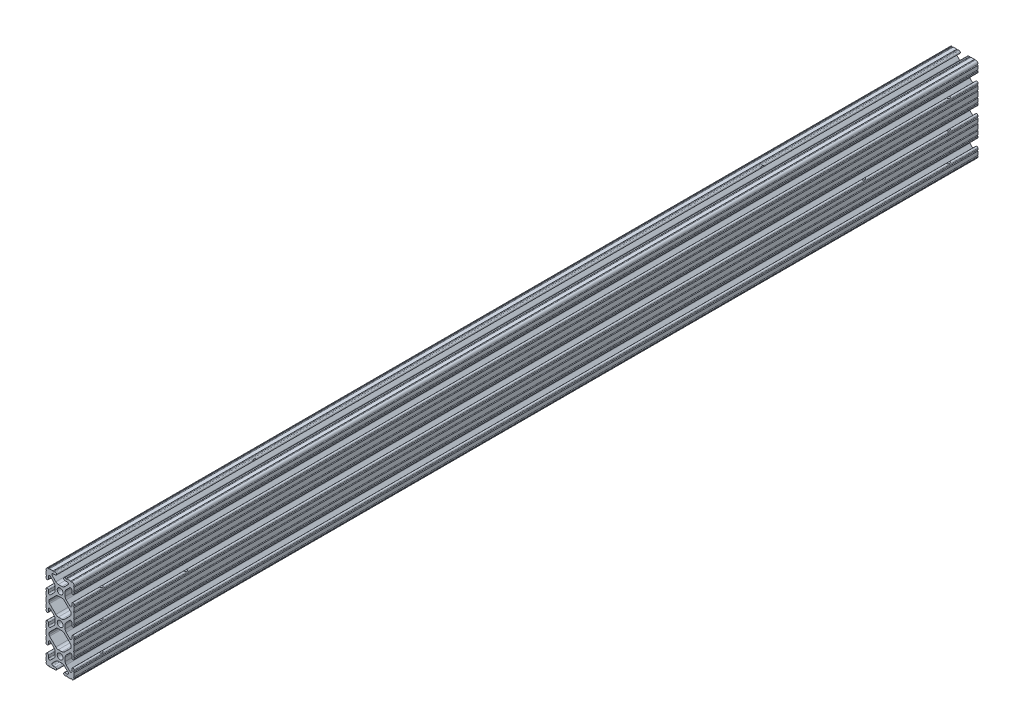
from build123d import *

# Parameters (mm, degrees)
SKETCH1_R               = 2.6035
BOSS_EXTRUDE1_DEPTH     = 406.4
CUT_EXTRUDE1_DEPTH      = 409.544636002
CUT_EXTRUDE1_DEPTH_BACK = 409.544636002
SKETCH2_R               = 3.5
CUT_EXTRUDE2_DEPTH      = 409.544636102
CUT_EXTRUDE2_DEPTH_BACK = 409.544636102
SKETCH3_R               = 3.5
CUT_EXTRUDE3_DEPTH      = 413.246808546
CUT_EXTRUDE3_DEPTH_BACK = 413.246808546
SKETCH4_R               = 3.5


with BuildPart() as part:
    # Sketch1 → Boss-Extrude1 (new, symmetric)
    with BuildSketch(Plane.XY):
        with BuildLine():
            Line((-12.7, 34.9504), (-12.7, 31.7246))
            ThreePointArc((-12.7, 31.7246), (-12.192, 31.2166), (-12.7, 30.7086))
            Line((-12.7, 30.7086), (-12.7, 29.702307889))
            ThreePointArc((-12.7, 29.702307889), (-11.5951, 28.597407889), (-10.4902, 29.702307889))
            Line((-10.4902, 29.702307889), (-10.4902, 31.874794456))
            ThreePointArc((-10.4902, 31.874794456), (-9.863006367, 32.813456061), (-8.75577951, 32.593214945))
            Line((-8.75577951, 32.593214945), (-5.43843597, 29.275871405))
            ThreePointArc((-5.43843597, 29.275871405), (-4.750182484, 28.245827272), (-4.5085, 27.030807374))
            Line((-4.5085, 27.030807374), (-4.5085, 23.769192626))
            ThreePointArc((-4.5085, 23.769192626), (-4.750182484, 22.554172728), (-5.43843597, 21.524128595))
            Line((-5.43843597, 21.524128595), (-8.75577951, 18.206785055))
            ThreePointArc((-8.75577951, 18.206785055), (-9.863006367, 17.986543939), (-10.4902, 18.925205544))
            Line((-10.4902, 18.925205544), (-10.4902, 21.097692111))
            ThreePointArc((-10.4902, 21.097692111), (-11.5951, 22.202592111), (-12.7, 21.097692111))
            Line((-12.7, 21.097692111), (-12.7, 20.0914))
            ThreePointArc((-12.7, 20.0914), (-12.192, 19.5834), (-12.7, 19.0754))
            Line((-12.7, 19.0754), (-12.7, 15.8496))
            ThreePointArc((-12.7, 15.8496), (-12.192, 15.3416), (-12.7, 14.8336))
            Line((-12.7, 14.8336), (-12.7, 10.5664))
            ThreePointArc((-12.7, 10.5664), (-12.192, 10.0584), (-12.7, 9.5504))
            Line((-12.7, 9.5504), (-12.7, 6.3246))
            ThreePointArc((-12.7, 6.3246), (-12.192000017, 5.8166), (-12.7, 5.3086))
            Line((-12.7, 5.3086), (-12.7, 4.302307889))
            ThreePointArc((-12.7, 4.302307889), (-11.5951, 3.197407889), (-10.4902, 4.302307889))
            Line((-10.4902, 4.302307889), (-10.4902, 6.474794456))
            ThreePointArc((-10.4902, 6.474794456), (-9.863006367, 7.413456061), (-8.75577951, 7.193214945))
            Line((-8.75577951, 7.193214945), (-5.43843597, 3.875871405))
            ThreePointArc((-5.43843597, 3.875871405), (-4.750182484, 2.845827272), (-4.5085, 1.630807374))
            Line((-4.5085, 1.630807374), (-4.5085, -1.630807374))
            ThreePointArc((-4.5085, -1.630807374), (-4.750182484, -2.845827272), (-5.43843597, -3.875871405))
            Line((-5.43843597, -3.875871405), (-8.75577951, -7.193214945))
            ThreePointArc((-8.75577951, -7.193214945), (-9.863006367, -7.413456061), (-10.4902, -6.474794456))
            Line((-10.4902, -6.474794456), (-10.4902, -4.302307889))
            ThreePointArc((-10.4902, -4.302307889), (-11.5951, -3.197407889), (-12.7, -4.302307889))
            Line((-12.7, -4.302307889), (-12.7, -5.3086))
            ThreePointArc((-12.7, -5.3086), (-12.191999983, -5.8166), (-12.7, -6.3246))
            Line((-12.7, -6.3246), (-12.7, -9.5504))
            ThreePointArc((-12.7, -9.5504), (-12.192, -10.0584), (-12.7, -10.5664))
            Line((-12.7, -10.5664), (-12.7, -14.8336))
            ThreePointArc((-12.7, -14.8336), (-12.192, -15.3416), (-12.7, -15.8496))
            Line((-12.7, -15.8496), (-12.7, -19.0754))
            ThreePointArc((-12.7, -19.0754), (-12.192, -19.5834), (-12.7, -20.0914))
            Line((-12.7, -20.0914), (-12.7, -21.097692111))
            ThreePointArc((-12.7, -21.097692111), (-11.5951, -22.202592111), (-10.4902, -21.097692111))
            Line((-10.4902, -21.097692111), (-10.4902, -18.925205544))
            ThreePointArc((-10.4902, -18.925205544), (-9.863006367, -17.986543939), (-8.75577951, -18.206785055))
            Line((-8.75577951, -18.206785055), (-5.43843597, -21.524128595))
            ThreePointArc((-5.43843597, -21.524128595), (-4.750182484, -22.554172728), (-4.5085, -23.769192626))
            Line((-4.5085, -23.769192626), (-4.5085, -27.030807374))
            ThreePointArc((-4.5085, -27.030807374), (-4.750182484, -28.245827272), (-5.43843597, -29.275871405))
            Line((-5.43843597, -29.275871405), (-8.75577951, -32.593214945))
            ThreePointArc((-8.75577951, -32.593214945), (-9.863006367, -32.813456061), (-10.4902, -31.874794456))
            Line((-10.4902, -31.874794456), (-10.4902, -29.702307889))
            ThreePointArc((-10.4902, -29.702307889), (-11.5951, -28.597407889), (-12.7, -29.702307889))
            Line((-12.7, -29.702307889), (-12.7, -30.7086))
            ThreePointArc((-12.7, -30.7086), (-12.192, -31.2166), (-12.7, -31.7246))
            Line((-12.7, -31.7246), (-12.7, -34.9504))
            ThreePointArc((-12.7, -34.9504), (-12.192, -35.4584), (-12.7, -35.9664))
            ThreePointArc((-12.7, -35.9664), (-12.082677406, -37.482677406), (-10.5664, -38.1))
            ThreePointArc((-10.5664, -38.1), (-10.0584, -37.592), (-9.5504, -38.1))
            Line((-9.5504, -38.1), (-6.3246, -38.1))
            ThreePointArc((-6.3246, -38.1), (-5.816599996, -37.592000017), (-5.3086, -38.100000008))
            Line((-5.3086, -38.100000008), (-4.302307889, -38.100000008))
            ThreePointArc((-4.302307889, -38.100000008), (-3.197407889, -36.995100008), (-4.302307889, -35.890200008))
            Line((-4.302307889, -35.890200008), (-6.474794456, -35.890200008))
            ThreePointArc((-6.474794456, -35.890200008), (-7.413456061, -35.263006376), (-7.193214945, -34.155779519))
            Line((-7.193214945, -34.155779519), (-3.875871405, -30.838435978))
            ThreePointArc((-3.875871405, -30.838435978), (-2.845827272, -30.150182493), (-1.630807374, -29.908500008))
            Line((-1.630807374, -29.908500008), (1.630807374, -29.908500008))
            ThreePointArc((1.630807374, -29.908500008), (2.845827272, -30.150182493), (3.875871405, -30.838435978))
            Line((3.875871405, -30.838435978), (7.193214945, -34.155779519))
            ThreePointArc((7.193214945, -34.155779519), (7.413456061, -35.263006376), (6.474794456, -35.890200008))
            Line((6.474794456, -35.890200008), (4.302307889, -35.890200008))
            ThreePointArc((4.302307889, -35.890200008), (3.197407889, -36.995100008), (4.302307889, -38.100000008))
            Line((4.302307889, -38.100000008), (5.3086, -38.100000008))
            ThreePointArc((5.3086, -38.100000008), (5.8166, -37.591999992), (6.3246, -38.100000008))
            Line((6.3246, -38.100000008), (9.5504, -38.100000008))
            ThreePointArc((9.5504, -38.100000008), (10.0584, -37.592000008), (10.5664, -38.100000008))
            ThreePointArc((10.5664, -38.100000008), (12.082677406, -37.482677414), (12.7, -35.966400008))
            ThreePointArc((12.7, -35.966400008), (12.192, -35.458400008), (12.7, -34.950400008))
            Line((12.7, -34.950400008), (12.7, -31.724600008))
            ThreePointArc((12.7, -31.724600008), (12.192, -31.216600008), (12.7, -30.708600008))
            Line((12.7, -30.708600008), (12.7, -29.702307926))
            ThreePointArc((12.7, -29.702307926), (11.5951, -28.597407926), (10.4902, -29.702307926))
            Line((10.4902, -29.702307926), (10.4902, -31.874794464))
            ThreePointArc((10.4902, -31.874794464), (9.863006367, -32.813456069), (8.75577951, -32.593214954))
            Line((8.75577951, -32.593214954), (5.43843597, -29.275871413))
            ThreePointArc((5.43843597, -29.275871413), (4.750182484, -28.245827281), (4.5085, -27.030807383))
            Line((4.5085, -27.030807383), (4.5085, -23.769192634))
            ThreePointArc((4.5085, -23.769192634), (4.750182484, -22.554172736), (5.43843597, -21.524128604))
            Line((5.43843597, -21.524128604), (8.75577951, -18.206785063))
            ThreePointArc((8.75577951, -18.206785063), (9.863006367, -17.986543948), (10.4902, -18.925205553))
            Line((10.4902, -18.925205553), (10.4902, -21.097692067))
            ThreePointArc((10.4902, -21.097692067), (11.5951, -22.202592067), (12.7, -21.097692067))
            Line((12.7, -21.097692067), (12.7, -20.091400008))
            ThreePointArc((12.7, -20.091400008), (12.192, -19.583400008), (12.7, -19.075400008))
            Line((12.7, -19.075400008), (12.7, -15.849600008))
            ThreePointArc((12.7, -15.849600008), (12.192, -15.341600008), (12.7, -14.833600008))
            Line((12.7, -14.833600008), (12.7, -10.566400008))
            ThreePointArc((12.7, -10.566400008), (12.192, -10.058400008), (12.7, -9.550400008))
            Line((12.7, -9.550400008), (12.7, -6.324600008))
            ThreePointArc((12.7, -6.324600008), (12.192000017, -5.816600008), (12.7, -5.308600008))
            Line((12.7, -5.308600008), (12.7, -4.302307897))
            ThreePointArc((12.7, -4.302307897), (11.5951, -3.197407897), (10.4902, -4.302307897))
            Line((10.4902, -4.302307897), (10.4902, -6.474794464))
            ThreePointArc((10.4902, -6.474794464), (9.863006367, -7.413456069), (8.75577951, -7.193214954))
            Line((8.75577951, -7.193214954), (5.43843597, -3.875871413))
            ThreePointArc((5.43843597, -3.875871413), (4.750182484, -2.845827281), (4.5085, -1.630807383))
            Line((4.5085, -1.630807383), (4.5085, 1.630807366))
            ThreePointArc((4.5085, 1.630807366), (4.750182484, 2.845827264), (5.43843597, 3.875871396))
            Line((5.43843597, 3.875871396), (8.75577951, 7.193214937))
            ThreePointArc((8.75577951, 7.193214937), (9.863006367, 7.413456052), (10.4902, 6.474794447))
            Line((10.4902, 6.474794447), (10.4902, 4.302307881))
            ThreePointArc((10.4902, 4.302307881), (11.5951, 3.197407881), (12.7, 4.302307881))
            Line((12.7, 4.302307881), (12.7, 5.308599992))
            ThreePointArc((12.7, 5.308599992), (12.191999983, 5.816599992), (12.7, 6.324599992))
            Line((12.7, 6.324599992), (12.7, 9.550399992))
            ThreePointArc((12.7, 9.550399992), (12.192, 10.058399992), (12.7, 10.566399992))
            Line((12.7, 10.566399992), (12.7, 14.833599992))
            ThreePointArc((12.7, 14.833599992), (12.192, 15.341599992), (12.7, 15.849599992))
            Line((12.7, 15.849599992), (12.7, 19.075399992))
            ThreePointArc((12.7, 19.075399992), (12.192, 19.583399992), (12.7, 20.091399992))
            Line((12.7, 20.091399992), (12.7, 21.097692074))
            ThreePointArc((12.7, 21.097692074), (11.5951, 22.202592074), (10.4902, 21.097692074))
            Line((10.4902, 21.097692074), (10.4902, 18.925205536))
            ThreePointArc((10.4902, 18.925205536), (9.863006367, 17.986543931), (8.75577951, 18.206785046))
            Line((8.75577951, 18.206785046), (5.43843597, 21.524128587))
            ThreePointArc((5.43843597, 21.524128587), (4.750182484, 22.554172719), (4.5085, 23.769192617))
            Line((4.5085, 23.769192617), (4.5085, 27.030807366))
            ThreePointArc((4.5085, 27.030807366), (4.750182484, 28.245827264), (5.43843597, 29.275871396))
            Line((5.43843597, 29.275871396), (8.75577951, 32.593214937))
            ThreePointArc((8.75577951, 32.593214937), (9.863006367, 32.813456052), (10.4902, 31.874794447))
            Line((10.4902, 31.874794447), (10.4902, 29.702307881))
            ThreePointArc((10.4902, 29.702307881), (11.5951, 28.597407881), (12.7, 29.702307881))
            Line((12.7, 29.702307881), (12.7, 30.708599992))
            ThreePointArc((12.7, 30.708599992), (12.192, 31.216599992), (12.7, 31.724599992))
            Line((12.7, 31.724599992), (12.7, 34.9504))
            ThreePointArc((12.7, 34.9504), (12.192, 35.4584), (12.7, 35.9664))
            ThreePointArc((12.7, 35.9664), (12.082677406, 37.482677406), (10.5664, 38.1))
            ThreePointArc((10.5664, 38.1), (10.0584, 37.592), (9.5504, 38.1))
            Line((9.5504, 38.1), (6.3246, 38.1))
            ThreePointArc((6.3246, 38.1), (5.8166, 37.591999983), (5.3086, 38.1))
            Line((5.3086, 38.1), (4.302307889, 38.1))
            ThreePointArc((4.302307889, 38.1), (3.197407889, 36.9951), (4.302307889, 35.8902))
            Line((4.302307889, 35.8902), (6.474794456, 35.8902))
            ThreePointArc((6.474794456, 35.8902), (7.413456061, 35.263006367), (7.193214945, 34.15577951))
            Line((7.193214945, 34.15577951), (3.875871405, 30.83843597))
            ThreePointArc((3.875871405, 30.83843597), (2.845827272, 30.150182484), (1.630807374, 29.9085))
            Line((1.630807374, 29.9085), (-1.630807374, 29.9085))
            ThreePointArc((-1.630807374, 29.9085), (-2.845827272, 30.150182484), (-3.875871405, 30.83843597))
            Line((-3.875871405, 30.83843597), (-7.193214945, 34.15577951))
            ThreePointArc((-7.193214945, 34.15577951), (-7.413456061, 35.263006367), (-6.474794456, 35.8902))
            Line((-6.474794456, 35.8902), (-4.302307889, 35.8902))
            ThreePointArc((-4.302307889, 35.8902), (-3.197407889, 36.9951), (-4.302307889, 38.1))
            Line((-4.302307889, 38.1), (-5.3086, 38.1))
            ThreePointArc((-5.3086, 38.1), (-5.8166, 37.592000017), (-6.3246, 38.1))
            Line((-6.3246, 38.1), (-9.5504, 38.1))
            ThreePointArc((-9.5504, 38.1), (-10.0584, 37.592), (-10.5664, 38.1))
            ThreePointArc((-10.5664, 38.1), (-12.082677406, 37.482677406), (-12.7, 35.9664))
            ThreePointArc((-12.7, 35.9664), (-12.192, 35.4584), (-12.7, 34.9504))
        make_face()
        with Locations((0, -25.4)):
            Circle(SKETCH1_R, mode=Mode.SUBTRACT)
        Circle(SKETCH1_R, mode=Mode.SUBTRACT)
        with Locations((0, 25.4)):
            Circle(SKETCH1_R, mode=Mode.SUBTRACT)
        with BuildLine():
            Line((-9.9314, -12.146268083), (-9.9314, -13.253731917))
            ThreePointArc((-9.9314, -13.253731917), (-9.811525488, -13.856381786), (-9.470151759, -14.367283676))
            Line((-9.470151759, -14.367283676), (-3.875871405, -19.96156403))
            ThreePointArc((-3.875871405, -19.96156403), (-2.845827272, -20.649817516), (-1.630807374, -20.8915))
            Line((-1.630807374, -20.8915), (1.630807374, -20.8915))
            ThreePointArc((1.630807374, -20.8915), (2.845827272, -20.649817516), (3.875871405, -19.96156403))
            Line((3.875871405, -19.96156403), (9.470151759, -14.367283676))
            ThreePointArc((9.470151759, -14.367283676), (9.811525488, -13.856381786), (9.9314, -13.253731917))
            Line((9.9314, -13.253731917), (9.9314, -12.146268083))
            ThreePointArc((9.9314, -12.146268083), (9.811525488, -11.543618214), (9.470151759, -11.032716324))
            Line((9.470151759, -11.032716324), (3.875871405, -5.43843597))
            ThreePointArc((3.875871405, -5.43843597), (2.845827272, -4.750182484), (1.630807374, -4.5085))
            Line((1.630807374, -4.5085), (-1.630807374, -4.5085))
            ThreePointArc((-1.630807374, -4.5085), (-2.845827272, -4.750182484), (-3.875871405, -5.43843597))
            Line((-3.875871405, -5.43843597), (-9.470151759, -11.032716324))
            ThreePointArc((-9.470151759, -11.032716324), (-9.811525488, -11.543618214), (-9.9314, -12.146268083))
        make_face(mode=Mode.SUBTRACT)
        with BuildLine():
            Line((-9.9314, 13.253731917), (-9.9314, 12.146268083))
            ThreePointArc((-9.9314, 12.146268083), (-9.811525488, 11.543618214), (-9.470151759, 11.032716324))
            Line((-9.470151759, 11.032716324), (-3.875871405, 5.43843597))
            ThreePointArc((-3.875871405, 5.43843597), (-2.845827272, 4.750182484), (-1.630807374, 4.5085))
            Line((-1.630807374, 4.5085), (1.630807374, 4.5085))
            ThreePointArc((1.630807374, 4.5085), (2.845827272, 4.750182484), (3.875871405, 5.43843597))
            Line((3.875871405, 5.43843597), (9.470151759, 11.032716324))
            ThreePointArc((9.470151759, 11.032716324), (9.811525488, 11.543618214), (9.9314, 12.146268083))
            Line((9.9314, 12.146268083), (9.9314, 13.253731917))
            ThreePointArc((9.9314, 13.253731917), (9.811525488, 13.856381786), (9.470151759, 14.367283676))
            Line((9.470151759, 14.367283676), (3.875871405, 19.96156403))
            ThreePointArc((3.875871405, 19.96156403), (2.845827272, 20.649817516), (1.630807374, 20.8915))
            Line((1.630807374, 20.8915), (-1.630807374, 20.8915))
            ThreePointArc((-1.630807374, 20.8915), (-2.845827272, 20.649817516), (-3.875871405, 19.96156403))
            Line((-3.875871405, 19.96156403), (-9.470151759, 14.367283676))
            ThreePointArc((-9.470151759, 14.367283676), (-9.811525488, 13.856381786), (-9.9314, 13.253731917))
        make_face(mode=Mode.SUBTRACT)
    extrude(amount=BOSS_EXTRUDE1_DEPTH, both=True)

    # Sketch2 → Cut-Extrude1 (cut, two sides: drawn at the far end of the back side and taken through both)
    with BuildSketch(Plane(origin=(4.5085, 0, 0), x_dir=(0, 0, -1), z_dir=(1, 0, 0)).offset(-CUT_EXTRUDE1_DEPTH_BACK)):
        with Locations((-381, 25.4)):
            Circle(SKETCH2_R)
        with Locations((-381, 0)):
            Circle(SKETCH2_R)
        with Locations((-381, -25.4)):
            Circle(SKETCH2_R)
        with Locations((381, 25.4)):
            Circle(SKETCH2_R)
        with Locations((381, 0)):
            Circle(SKETCH2_R)
        with Locations((381, -25.4)):
            Circle(SKETCH2_R)
    extrude(amount=CUT_EXTRUDE1_DEPTH + CUT_EXTRUDE1_DEPTH_BACK, mode=Mode.SUBTRACT)

    # Sketch3 → Cut-Extrude2 (cut, two sides: drawn at the far end of the back side and taken through both)
    with BuildSketch(Plane(origin=(4.5085, 0, 0), x_dir=(0, 0, -1), z_dir=(1, 0, 0)).offset(-CUT_EXTRUDE2_DEPTH_BACK)):
        with Locations((-304.8, 0)):
            Circle(SKETCH3_R)
        with Locations((304.8, 0)):
            Circle(SKETCH3_R)
    extrude(amount=CUT_EXTRUDE2_DEPTH + CUT_EXTRUDE2_DEPTH_BACK, mode=Mode.SUBTRACT)

    # Sketch4 → Cut-Extrude3 (cut, two sides: drawn at the far end of the back side and taken through both)
    with BuildSketch(Plane.XZ.offset(29.908500008).offset(-CUT_EXTRUDE3_DEPTH_BACK)):
        with Locations((0, 228.53)):
            Circle(SKETCH4_R)
        with Locations((0, -228.53)):
            Circle(SKETCH4_R)
    extrude(amount=CUT_EXTRUDE3_DEPTH + CUT_EXTRUDE3_DEPTH_BACK, mode=Mode.SUBTRACT)


solid = part.part
